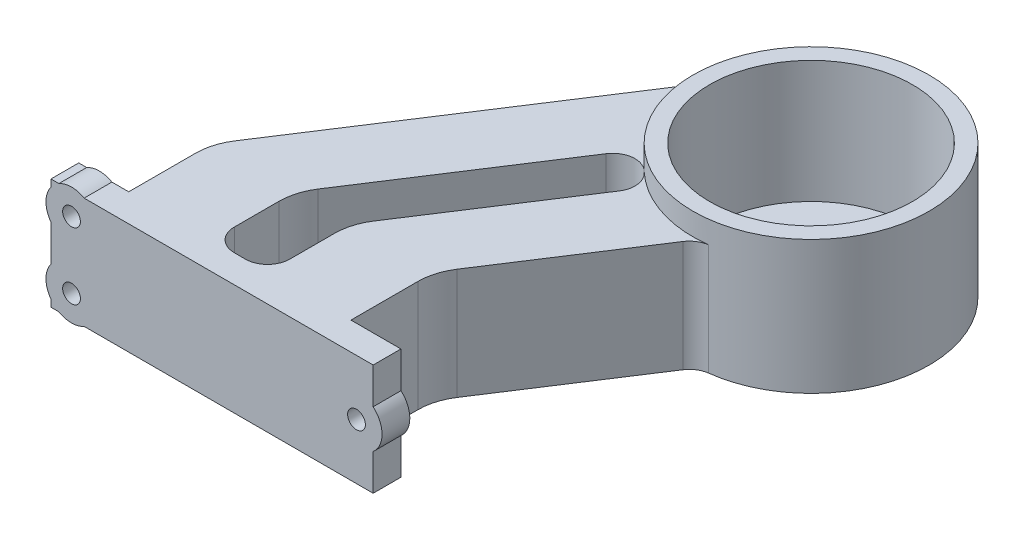
from build123d import *

# Parameters (mm, degrees)
SKETCH1_R           = 18.25
SKETCH1_R_2         = 1.6
SKETCH1_R_3         = 11.5
BOSS_EXTRUDE1_DEPTH = 2
SKETCH1_3_R         = 21.25
SKETCH1_3_R_2       = 18.25
BOSS_EXTRUDE2_DEPTH = 24
BOSS_EXTRUDE3_DEPTH = 20
SKETCH3_R           = 1.6
BOSS_EXTRUDE4_DEPTH = 5
FILLET3_R           = 10
FILLET4_R           = 4


with BuildPart() as part:
    # Sketch1 → Boss-Extrude1 (new body)
    with BuildSketch(Plane(origin=(0, 0, 0), x_dir=(1, 0, 0), z_dir=(0, 1, 0))):
        Circle(SKETCH1_R)
        with Locations((-14, 0)):
            Circle(SKETCH1_R_2, mode=Mode.SUBTRACT)
        with Locations((0, -14)):
            Circle(SKETCH1_R_2, mode=Mode.SUBTRACT)
        Circle(SKETCH1_R_3, mode=Mode.SUBTRACT)
        with Locations((14, 0)):
            Circle(SKETCH1_R_2, mode=Mode.SUBTRACT)
        with Locations((0, 14)):
            Circle(SKETCH1_R_2, mode=Mode.SUBTRACT)
    extrude(amount=BOSS_EXTRUDE1_DEPTH)

    # Sketch1<3> → Boss-Extrude2 (add)
    with BuildSketch(Plane(origin=(0, 0, 0), x_dir=(1, 0, 0), z_dir=(0, 1, 0))):
        Circle(SKETCH1_3_R)
        Circle(SKETCH1_3_R_2, mode=Mode.SUBTRACT)
    extrude(amount=BOSS_EXTRUDE2_DEPTH)

    # Sketch2 → Boss-Extrude3 (add)
    with BuildSketch(Plane(origin=(0, 0, 0), x_dir=(1, 0, 0), z_dir=(0, 1, 0))):
        with BuildLine():
            ThreePointArc((-17.839967658, -11.545477642), (-21.249992199, 0.018208346), (-17.820155675, 11.576033506))
            Line((-17.820155675, 11.576033506), (-57.820155675, -50))
            Line((-57.820155675, -50), (-57.820155675, -70))
            Line((-57.820155675, -70), (-42.820155675, -70))
            Line((-42.820155675, -70), (-42.820155675, -50))
            Line((-42.820155675, -50), (-17.839967658, -11.545477642))
        make_face()
        with BuildLine():
            Line((-17.820155675, -50), (0.867447809, -21.232287543))
            ThreePointArc((0.867447809, -21.232287543), (-5.756886716, -20.45533562), (-11.81408432, -17.663236161))
            Line((-11.81408432, -17.663236161), (-32.820155675, -50))
            Line((-32.820155675, -50), (-32.820155675, -70))
            Line((-32.820155675, -70), (-17.820155675, -70))
            Line((-17.820155675, -70), (-17.820155675, -50))
        make_face()
    extrude(amount=BOSS_EXTRUDE3_DEPTH)

    # Sketch3 → Boss-Extrude4 (add)
    with BuildSketch(Plane.XY.offset(70)):
        with BuildLine():
            Line((-65.389940295, 20), (-66.820155675, 20))
            Line((-66.820155675, 20), (-66.820155675, 18.730720476))
            ThreePointArc((-66.820155675, 18.730720476), (-67.718376956, 16), (-66.820155675, 13.269279524))
            Line((-66.820155675, 13.269279524), (-66.820155675, 6.730720476))
            ThreePointArc((-66.820155675, 6.730720476), (-67.718376956, 4), (-66.820155675, 1.269279524))
            Line((-66.820155675, 1.269279524), (-66.820155675, 0))
            Line((-66.820155675, 0), (-65.389940295, 0))
            ThreePointArc((-65.389940295, 0), (-63.118376956, -0.6), (-60.846813618, 0))
            Line((-60.846813618, 0), (-8.820155675, 0))
            Line((-8.820155675, 0), (-8.820155675, 6.512880845))
            ThreePointArc((-8.820155675, 6.512880845), (-7.220155675, 10), (-8.820155675, 13.487119155))
            Line((-8.820155675, 13.487119155), (-8.820155675, 20))
            Line((-8.820155675, 20), (-60.846813618, 20))
            ThreePointArc((-60.846813618, 20), (-63.118376956, 20.6), (-65.389940295, 20))
        make_face()
        with Locations((-63.118376956, 16)):
            Circle(SKETCH3_R, mode=Mode.SUBTRACT)
        with Locations((-11.820155675, 10)):
            Circle(SKETCH3_R, mode=Mode.SUBTRACT)
        with Locations((-63.118376956, 4)):
            Circle(SKETCH3_R, mode=Mode.SUBTRACT)
    extrude(amount=-BOSS_EXTRUDE4_DEPTH)

    # Fillet3
    fillet3_edges = [part.edges().sort_by_distance(p)[0] for p in [
        (-57.820155675, 10, 50),
        (-32.820155675, 10, 50),
        (-42.820155675, 10, 50),
        (-17.820155675, 10, 50),
    ]]
    fillet(fillet3_edges, radius=FILLET3_R)

    # Fillet4
    fillet4_edges = [part.edges().sort_by_distance(p)[0] for p in [
        (-42.820155675, 10, 65),
        (-32.820155675, 10, 65),
        (-17.839967658, 10, 11.545477642),
        (0.867447809, 10, 21.232287543),
        (-11.81408432, 10, 17.663236161),
    ]]
    fillet(fillet4_edges, radius=FILLET4_R)


solid = part.part
